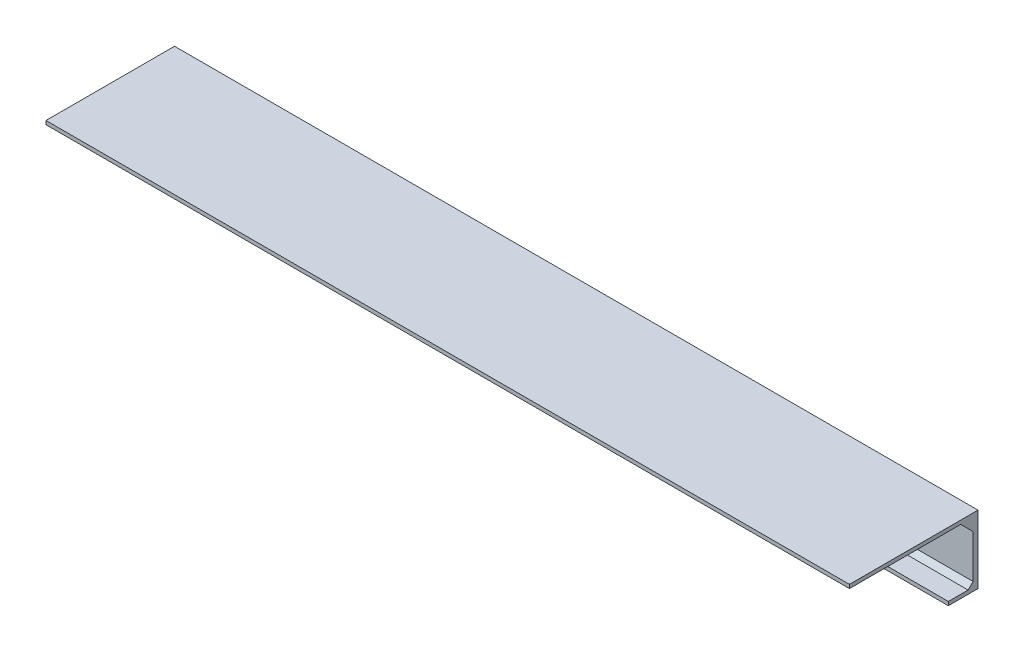
from build123d import *

# Parameters (mm, degrees)
SKETCH_1_W      = 130
SKETCH_1_H      = 11
EXTRUDE_1_DEPTH = 0.8
SKETCH_2_W      = 130
SKETCH_2_H      = 0.6
EXTRUDE_2_DEPTH = 20
SKETCH_3_W      = 130
SKETCH_3_H      = 2
EXTRUDE_3_DEPTH = 2
CHAMFER_1_SIZE  = 2
SKETCH_4_W      = 130
SKETCH_4_H      = 0.6
EXTRUDE_4_DEPTH = 4
SKETCH_5_W      = 130
SKETCH_5_H      = 0.8
EXTRUDE_5_DEPTH = 0.8
CHAMFER_2_SIZE  = 0.8


with BuildPart() as part:
    # 草图1 → 凸台-拉伸1 (new body)
    with BuildSketch(Plane.XY):
        Rectangle(SKETCH_1_W, SKETCH_1_H)
    extrude(amount=EXTRUDE_1_DEPTH)

    # 草图2 → 凸台-拉伸2 (add)
    with BuildSketch(Plane.XY.offset(0.8)):
        with Locations((0, 5.2)):
            Rectangle(SKETCH_2_W, SKETCH_2_H)
    extrude(amount=EXTRUDE_2_DEPTH)

    # 草图3 → 凸台-拉伸3 (add)
    with BuildSketch(Plane.XY.offset(0.8)):
        with Locations((0, 3.9)):
            Rectangle(SKETCH_3_W, SKETCH_3_H)
    extrude(amount=EXTRUDE_3_DEPTH)

    # 倒角1
    chamfer_1_edges = [part.edges().sort_by_distance(p)[0] for p in [
        (0, 2.9, 2.8),
    ]]
    chamfer(chamfer_1_edges, length=CHAMFER_1_SIZE - 0.0001)  # a hair under: the kernel refuses the full size

    # 草图4 → 凸台-拉伸4 (add)
    with BuildSketch(Plane.XY.offset(0.8)):
        with Locations((0, -5.2)):
            Rectangle(SKETCH_4_W, SKETCH_4_H)
    extrude(amount=EXTRUDE_4_DEPTH)

    # 草图5 → 凸台-拉伸5 (add)
    with BuildSketch(Plane.XY.offset(0.8)):
        with Locations((0, -4.5)):
            Rectangle(SKETCH_5_W, SKETCH_5_H)
    extrude(amount=EXTRUDE_5_DEPTH)

    # 倒角2
    chamfer_2_edges = [part.edges().sort_by_distance(p)[0] for p in [
        (0, -4.1, 1.6),
    ]]
    chamfer(chamfer_2_edges, length=CHAMFER_2_SIZE - 0.0001)  # a hair under: the kernel refuses the full size


solid = part.part
